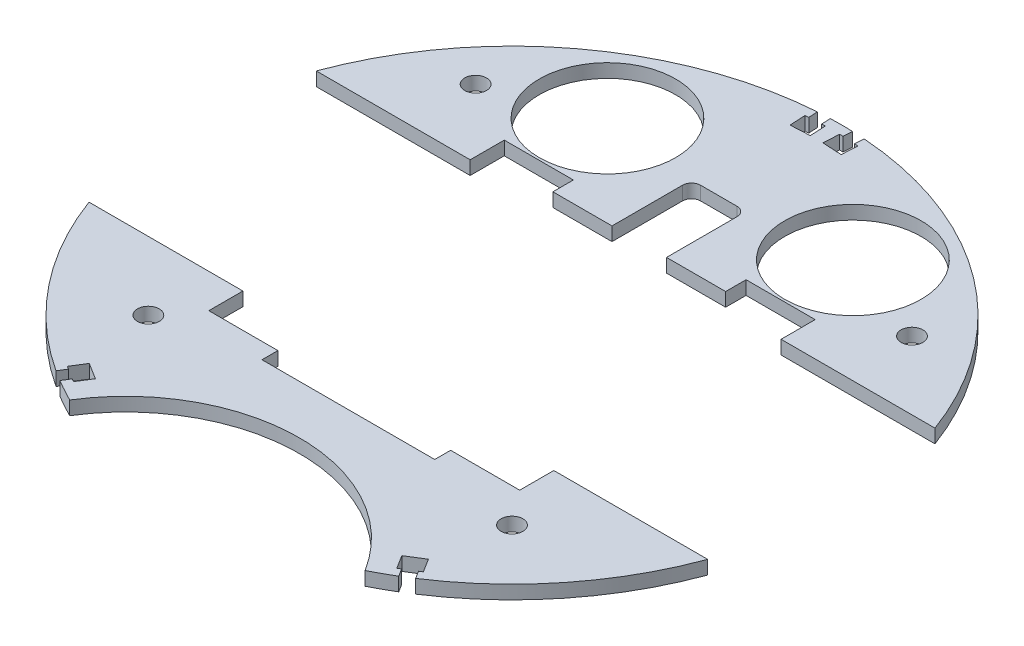
from build123d import *

# Parameters (mm, degrees)
BOSS_EXTRUDE1_DEPTH  = 3
SOLENOID_PLACEMENT_W = 38
SOLENOID_PLACEMENT_H = 64
CUT_EXTRUDE1_DEPTH   = 103.574363269
SKETCH7_R            = 15
CUT_EXTRUDE6_DEPTH   = 103.574363269
SKETCH8_R            = 2.4
CUT_EXTRUDE7_DEPTH   = 103.574363269
CUT_EXTRUDE3_DEPTH   = 103.574363269
CUT_EXTRUDE8_DEPTH   = 100.481326336
CUT_EXTRUDE9_DEPTH   = 100.481326336


with BuildPart() as part:
    # Sketch1 → Boss-Extrude1 (new body)
    with BuildSketch(Plane(origin=(0, 0, 0), x_dir=(1, 0, 0), z_dir=(0, 1, 0))):
        with BuildLine():
            ThreePointArc((32.48910875, -64.812867647), (0, 72.5), (-32.48910875, -64.812867647))
            ThreePointArc((-32.48910875, -64.812867647), (0, -46.75), (32.48910875, -64.812867647))
        make_face()
    extrude(amount=BOSS_EXTRUDE1_DEPTH)

    # solenoid placement → Cut-Extrude1 (cut, through all)
    with BuildSketch(Plane(origin=(0, 3, 0), x_dir=(1, 0, 0), z_dir=(0, 1, 0))):
        with Locations((0, -4)):
            Rectangle(SOLENOID_PLACEMENT_W, SOLENOID_PLACEMENT_H)
    extrude(amount=-CUT_EXTRUDE1_DEPTH, mode=Mode.SUBTRACT)

    # Sketch7 → Cut-Extrude6 (cut, through all)
    with BuildSketch(Plane(origin=(0, 3, 0), x_dir=(1, 0, 0), z_dir=(0, 1, 0))):
        with Locations((27, 48)):
            Circle(SKETCH7_R)
        with Locations((-27, 48)):
            Circle(SKETCH7_R)
    extrude(amount=-CUT_EXTRUDE6_DEPTH, mode=Mode.SUBTRACT)

    # Sketch8 → Cut-Extrude7 (cut, through all)
    with BuildSketch(Plane(origin=(0, 3, 0), x_dir=(1, 0, 0), z_dir=(0, 1, 0))):
        with Locations((40, -40)):
            Circle(SKETCH8_R)
        with Locations((-40, -40)):
            Circle(SKETCH8_R)
        with Locations((48, 40)):
            Circle(SKETCH8_R)
        with Locations((-48, 40)):
            Circle(SKETCH8_R)
    extrude(amount=-CUT_EXTRUDE7_DEPTH, mode=Mode.SUBTRACT)

    # Sketch3 → Cut-Extrude3 (cut, through all)
    with BuildSketch(Plane(origin=(0, 3, 0), x_dir=(1, 0, 0), z_dir=(0, 1, 0))):
        with BuildLine():
            Line((-34.2, -32.500685802), (-22.2, -32.500685802))
            Line((-22.2, -32.500685802), (-19, -32.500685802))
            Line((-19, -32.500685802), (-19, 32.499314198))
            Line((-19, 32.499314198), (-22.2, 32.499314198))
            Line((-22.2, 32.499314198), (-34.2, 32.499314198))
            Line((-34.2, 32.499314198), (-34.2, 24.999314198))
            Line((-34.2, 24.999314198), (-68.053539876, 24.999314198))
            ThreePointArc((-68.053539876, 24.999314198), (-72.499999996, -0.000730613), (-68.053036005, -25.000685802))
            Line((-68.053036005, -25.000685802), (-34.2, -25.000685802))
            Line((-34.2, -25.000685802), (-34.2, -32.500685802))
        make_face()
        with BuildLine():
            Line((19, 32.499314198), (19, -32.500685802))
            Line((19, -32.500685802), (22.2, -32.500685802))
            Line((22.2, -32.500685802), (34.2, -32.500685802))
            Line((34.2, -32.500685802), (34.2, -25.000685802))
            Line((34.2, -25.000685802), (68.053036005, -25.000685802))
            ThreePointArc((68.053036005, -25.000685802), (72.499999996, -0.000730613), (68.053539876, 24.999314198))
            Line((68.053539876, 24.999314198), (34.2, 24.999314198))
            Line((34.2, 24.999314198), (34.2, 32.499314198))
            Line((34.2, 32.499314198), (22.2, 32.499314198))
            Line((22.2, 32.499314198), (19, 32.499314198))
        make_face()
    extrude(amount=-CUT_EXTRUDE3_DEPTH, mode=Mode.SUBTRACT)


with BuildPart() as cut_extrude3_piece_1:
    # of the separate pieces the step leaves, piece 1, a body of its own (cut_extrude3_pieces)
    add(part.part.solids().sort_by_distance((68.053539876, 0, -24.999314198))[0])

    # Sketch9 → Cut-Extrude8 (cut, through all)
    with BuildSketch(Plane(origin=(0, 3, 0), x_dir=(1, 0, 0), z_dir=(0, 1, 0))):
        with BuildLine():
            Line((6, 43.5), (6, 28))
            Line((6, 28), (-6, 28))
            Line((-6, 28), (-6, 43.5))
            ThreePointArc((-6, 43.5), (-5.414213562, 44.914213562), (-4, 45.5))
            Line((-4, 45.5), (4, 45.5))
            ThreePointArc((4, 45.5), (5.414213562, 44.914213562), (6, 43.5))
        make_face()
    extrude(amount=-CUT_EXTRUDE8_DEPTH, mode=Mode.SUBTRACT)


with BuildPart() as cut_extrude3_piece_2:
    # of the separate pieces the step leaves, piece 2, a body of its own (cut_extrude3_pieces)
    add(part.part.solids().sort_by_distance((32.48910875, 0, 64.812867647))[0])


with BuildPart() as cut_extrude9_tool:
    # Sketch10 → Cut-Extrude9 (new, through all)
    with BuildSketch(Plane(origin=(0, 3, 0), x_dir=(1, 0, 0), z_dir=(0, 1, 0))):
        Polygon((1.384421307, 67.019392736), (5.62859683, 66.796964922), (5.811772676, 70.292168293), (5.037834787, 70.332728659), (5.1425067, 72.329987729), (2.446206956, 72.471294811), (2.341535043, 70.474035741), (1.567597154, 70.514596107), align=None)
        Polygon((-5.037834787, 70.332728659), (-5.811772676, 70.292168293), (-5.62859683, 66.796964922), (-1.384421307, 67.019392736), (-1.567597154, 70.514596107), (-2.341535043, 70.474035741), (-2.446206956, 72.471294811), (-5.1425067, 72.329987729), align=None)
        Polygon((37.306692908, -55.693144006), (33.702488499, -57.945300879), (35.557205924, -60.913469216), (36.214443199, -60.502781786), (37.274281727, -62.198877978), (39.564011587, -60.768095965), (38.504173058, -59.071999772), (39.161410333, -58.661312343), align=None)
        Polygon((-33.702488499, -57.945300879), (-37.306692908, -55.693144006), (-39.161410333, -58.661312343), (-38.504173058, -59.071999772), (-39.564011587, -60.768095965), (-37.274281727, -62.198877978), (-36.214443199, -60.502781786), (-35.557205924, -60.913469216), align=None)
    extrude(amount=-CUT_EXTRUDE9_DEPTH)


with BuildPart() as cut_extrude3_piece_1_1:
    add(cut_extrude3_piece_1.part)

    # Cut-Extrude9: cut by cut_extrude9_tool
    add(cut_extrude9_tool.part, mode=Mode.SUBTRACT)


with BuildPart() as cut_extrude3_piece_2_1:
    add(cut_extrude3_piece_2.part)

    # Cut-Extrude9: cut by cut_extrude9_tool
    add(cut_extrude9_tool.part, mode=Mode.SUBTRACT)


solid = Compound([cut_extrude3_piece_1_1.part, cut_extrude3_piece_2_1.part])
